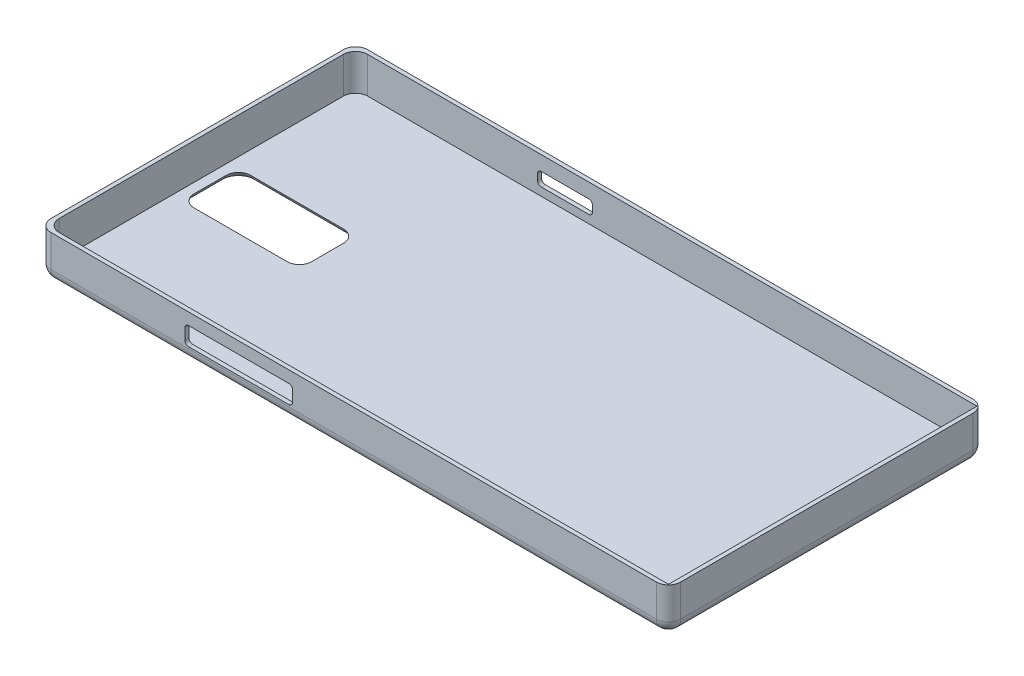
from build123d import *

# Parameters (mm, degrees)
SKETCH1_W           = 154.9
SKETCH1_H           = 77.9
BOSS_EXTRUDE1_DEPTH = 10.9
SKETCH8_W           = 152.9
SKETCH8_H           = 75.9
CUT_EXTRUDE3_DEPTH  = 8.9
FILLET6_R           = 2.99
FILLET7_R           = 2.99
FILLET8_R           = 2.99
FILLET9_R           = 2.99
FILLET10_R          = 2.99
FILLET11_R          = 2.99
FILLET12_R          = 2.99
FILLET13_R          = 2.99
SKETCH12_W          = 28.9
SKETCH12_H          = 13.9
CUT_EXTRUDE4_DEPTH  = 88.148235782
FILLET15_R          = 2.99
FILLET16_R          = 2.99
FILLET17_R          = 2.99
FILLET18_R          = 2.99
CUT_EXTRUDE8_REACH  = 112.389
SKETCH15_W          = 26.5
SKETCH15_H          = 4.5
CUT_EXTRUDE9_REACH  = 112.389
SKETCH16_W          = 13.5
SKETCH16_H          = 3.3
FILLET19_R          = 2.99
FILLET22_R          = 0.9
FILLET23_R          = 0.9
FILLET24_R          = 0.9
FILLET25_R          = 0.9
FILLET29_R          = 0.9
FILLET39_R          = 2.99
SKETCH6_W           = 152.9
SKETCH6_H           = 75.9
CUT_EXTRUDE2_DEPTH  = 8.9
FILLET4_R           = 2.99
FILLET5_R           = 2.99


with BuildPart() as part:
    # Sketch1 → Boss-Extrude1 (new body)
    with BuildSketch(Plane(origin=(0, 0, 0), x_dir=(1, 0, 0), z_dir=(0, 1, 0))):
        Rectangle(SKETCH1_W, SKETCH1_H)
    extrude(amount=BOSS_EXTRUDE1_DEPTH)

    # Sketch8 → Cut-Extrude3 (cut)
    with BuildSketch(Plane(origin=(0, 10.9, 0), x_dir=(1, 0, 0), z_dir=(0, 1, 0))):
        Rectangle(SKETCH8_W, SKETCH8_H)
    extrude(amount=-CUT_EXTRUDE3_DEPTH, mode=Mode.SUBTRACT)

    # Fillet6
    fillet6_edges = [part.edges().sort_by_distance(p)[0] for p in [
        (-76.45, 6.45, -37.95),
    ]]
    fillet(fillet6_edges, radius=FILLET6_R)

    # Fillet7
    fillet7_edges = [part.edges().sort_by_distance(p)[0] for p in [
        (-76.45, 6.45, 37.95),
    ]]
    fillet(fillet7_edges, radius=FILLET7_R)

    # Fillet8
    fillet8_edges = [part.edges().sort_by_distance(p)[0] for p in [
        (76.45, 6.45, -37.95),
    ]]
    fillet(fillet8_edges, radius=FILLET8_R)

    # Fillet9
    fillet9_edges = [part.edges().sort_by_distance(p)[0] for p in [
        (76.45, 6.45, 37.95),
    ]]
    fillet(fillet9_edges, radius=FILLET9_R)

    # Fillet10
    fillet10_edges = [part.edges().sort_by_distance(p)[0] for p in [
        (77.45, 5.45, 38.95),
    ]]
    fillet(fillet10_edges, radius=FILLET10_R)

    # Fillet11
    fillet11_edges = [part.edges().sort_by_distance(p)[0] for p in [
        (-77.45, 5.45, 38.95),
    ]]
    fillet(fillet11_edges, radius=FILLET11_R)

    # Fillet12
    fillet12_edges = [part.edges().sort_by_distance(p)[0] for p in [
        (-77.45, 5.45, -38.95),
    ]]
    fillet(fillet12_edges, radius=FILLET12_R)

    # Fillet13
    fillet13_edges = [part.edges().sort_by_distance(p)[0] for p in [
        (1.495, 0, -38.95),
        (77.45, 0, -1.495),
        (76.574249276, 0, 38.074249276),
        (0, 0, 38.95),
        (-76.574249276, 0, 38.074249276),
        (-77.45, 0, 0),
        (-76.574249276, 0, -38.074249276),
    ]]
    fillet(fillet13_edges, radius=FILLET13_R)

    # Sketch12 → Cut-Extrude4 (cut, through all)
    with BuildSketch(Plane(origin=(0, 2, 0), x_dir=(1, 0, 0), z_dir=(0, 1, 0))):
        with Locations((-59.543133303, -0.270064355)):
            Rectangle(SKETCH12_W, SKETCH12_H)
    extrude(amount=-CUT_EXTRUDE4_DEPTH, mode=Mode.SUBTRACT)

    # Fillet15
    fillet15_edges = [part.edges().sort_by_distance(p)[0] for p in [
        (-73.993133303, 1, -6.679935645),
    ]]
    fillet(fillet15_edges, radius=FILLET15_R)

    # Fillet16
    fillet16_edges = [part.edges().sort_by_distance(p)[0] for p in [
        (-73.993133303, 1, 7.220064355),
    ]]
    fillet(fillet16_edges, radius=FILLET16_R)

    # Fillet17
    fillet17_edges = [part.edges().sort_by_distance(p)[0] for p in [
        (-45.093133303, 1, 7.220064355),
    ]]
    fillet(fillet17_edges, radius=FILLET17_R)

    # Fillet18
    fillet18_edges = [part.edges().sort_by_distance(p)[0] for p in [
        (-45.093133303, 1, -6.679935645),
    ]]
    fillet(fillet18_edges, radius=FILLET18_R)

    # Sketch15 → Cut-Extrude8 (cut, up to next)
    with BuildSketch(Plane.XY.offset(38.95), mode=Mode.PRIVATE) as cut_extrude8_sk1:
        with Locations((-28.269520984, 5.746289853)):
            Rectangle(SKETCH15_W, SKETCH15_H)
    cut_extrude8_tool1 = extrude(cut_extrude8_sk1.sketch, amount=-CUT_EXTRUDE8_REACH, mode=Mode.PRIVATE) & part.part
    add(cut_extrude8_tool1.solids().sort_by_distance((-28.269521, 5.74629, 38.95))[0], mode=Mode.SUBTRACT)

    # Sketch16 → Cut-Extrude9 (cut, up to next)
    with BuildSketch(Plane(origin=(0, 0, -38.95), x_dir=(-1, 0, 0), z_dir=(0, 0, -1)), mode=Mode.PRIVATE) as cut_extrude9_sk1:
        with Locations((24.905722524, 5.653111576)):
            Rectangle(SKETCH16_W, SKETCH16_H)
    cut_extrude9_tool1 = extrude(cut_extrude9_sk1.sketch, amount=-CUT_EXTRUDE9_REACH, mode=Mode.PRIVATE) & part.part
    add(cut_extrude9_tool1.solids().sort_by_distance((-24.905723, 5.653112, -38.95))[0], mode=Mode.SUBTRACT)

    # Fillet19
    # the kernel refuses this fillet: 2.99 mm, written as the material it takes off along each edge
    with BuildSketch(Plane(origin=(-71.003133303, 0, 4.230064355), x_dir=(-1, 0, 0), z_dir=(0, 0, -1))) as fillet19_piece_1:
        with BuildLine():
            CenterArc((5.811347196, 2.99), FILLET19_R, 199.335777997, 70.664222003)
            Line((2.99, 2), (2.933573056, 1.9802))
            ThreePointArc((2.933573056, 1.9802), (2.9302, 1), (2.9302, 0))
            Line((2.9302, 0), (2.99, -0.0598))
            Line((2.99, -0.0598), (5.811347196, -0.0598))
            Line((5.811347196, -0.0598), (5.811347196, 0))
        make_face()
    revolve(axis=Axis((-71.003133303, 0, 4.230064355), (0, 1, 0)), revolution_arc=90, mode=Mode.SUBTRACT)
    with BuildSketch(Plane(origin=(-73.993133303, 0, -3.689935645), x_dir=(-1, 0, 0), z_dir=(0, 0, 1)), Plane(origin=(-45.093133303, 0, 4.230064355), x_dir=(1, 0, 0), z_dir=(0, 0, -1))) as fillet19_piece_2:
        with BuildLine():
            CenterArc((2.821347196, -2.99), FILLET19_R, 90, 70.664222003)
            Line((0, -2), (-0.056426944, -1.9802))
            ThreePointArc((-0.056426944, -1.9802), (-0.0598, -1), (-0.0598, 0))
            Line((-0.0598, 0), (0, 0.0598))
            Line((0, 0.0598), (2.821347196, 0.0598))
            Line((2.821347196, 0.0598), (2.821347196, 0))
        make_face()
    extrude(amount=7.92, mode=Mode.SUBTRACT)
    with BuildSketch(Plane(origin=(-71.003133303, 0, -3.689935645), x_dir=(0, 0, -1), z_dir=(1, 0, 0))) as fillet19_piece_3:
        with BuildLine():
            CenterArc((5.811347196, 2.99), FILLET19_R, 199.335777997, 70.664222003)
            Line((2.99, 2), (2.933573056, 1.9802))
            ThreePointArc((2.933573056, 1.9802), (2.9302, 1), (2.9302, 0))
            Line((2.9302, 0), (2.99, -0.0598))
            Line((2.99, -0.0598), (5.811347196, -0.0598))
            Line((5.811347196, -0.0598), (5.811347196, 0))
        make_face()
    revolve(axis=Axis((-71.003133303, 0, -3.689935645), (0, 1, 0)), revolution_arc=90, mode=Mode.SUBTRACT)
    with BuildSketch(Plane(origin=(-48.083133303, 0, -6.679935645), x_dir=(0, 0, -1), z_dir=(-1, 0, 0)), Plane(origin=(-71.003133303, 0, 7.220064355), x_dir=(0, 0, 1), z_dir=(1, 0, 0))) as fillet19_piece_4:
        with BuildLine():
            CenterArc((2.821347196, -2.99), FILLET19_R, 90, 70.664222003)
            Line((0, -2), (-0.056426944, -1.9802))
            ThreePointArc((-0.056426944, -1.9802), (-0.0598, -1), (-0.0598, 0))
            Line((-0.0598, 0), (0, 0.0598))
            Line((0, 0.0598), (2.821347196, 0.0598))
            Line((2.821347196, 0.0598), (2.821347196, 0))
        make_face()
    extrude(amount=22.92, mode=Mode.SUBTRACT)
    with BuildSketch(Plane(origin=(-48.083133303, 0, -3.689935645), x_dir=(1, 0, 0), z_dir=(0, 0, 1))) as fillet19_piece_5:
        with BuildLine():
            CenterArc((5.811347196, 2.99), FILLET19_R, 199.335777997, 70.664222003)
            Line((2.99, 2), (2.933573056, 1.9802))
            ThreePointArc((2.933573056, 1.9802), (2.9302, 1), (2.9302, 0))
            Line((2.9302, 0), (2.99, -0.0598))
            Line((2.99, -0.0598), (5.811347196, -0.0598))
            Line((5.811347196, -0.0598), (5.811347196, 0))
        make_face()
    revolve(axis=Axis((-48.083133303, 0, -3.689935645), (0, 1, 0)), revolution_arc=90, mode=Mode.SUBTRACT)
    with BuildSketch(Plane(origin=(-48.083133303, 0, 4.230064355), x_dir=(0, 0, 1), z_dir=(-1, 0, 0))) as fillet19_piece_6:
        with BuildLine():
            CenterArc((5.811347196, 2.99), FILLET19_R, 199.335777997, 70.664222003)
            Line((2.99, 2), (2.933573056, 1.9802))
            ThreePointArc((2.933573056, 1.9802), (2.9302, 1), (2.9302, 0))
            Line((2.9302, 0), (2.99, -0.0598))
            Line((2.99, -0.0598), (5.811347196, -0.0598))
            Line((5.811347196, -0.0598), (5.811347196, 0))
        make_face()
    revolve(axis=Axis((-48.083133303, 0, 4.230064355), (0, 1, 0)), revolution_arc=90, mode=Mode.SUBTRACT)

    # Fillet22
    fillet22_edges = [part.edges().sort_by_distance(p)[0] for p in [
        (-15.019520984, 7.996289853, 38.45),
    ]]
    fillet(fillet22_edges, radius=FILLET22_R)

    # Fillet23
    fillet23_edges = [part.edges().sort_by_distance(p)[0] for p in [
        (-41.519520984, 7.996289853, 38.45),
    ]]
    fillet(fillet23_edges, radius=FILLET23_R)

    # Fillet24
    fillet24_edges = [part.edges().sort_by_distance(p)[0] for p in [
        (-15.019520984, 3.496289853, 38.45),
    ]]
    fillet(fillet24_edges, radius=FILLET24_R)

    # Fillet25
    fillet25_edges = [part.edges().sort_by_distance(p)[0] for p in [
        (-41.519520984, 3.496289853, 38.45),
    ]]
    fillet(fillet25_edges, radius=FILLET25_R)

    # Fillet29
    fillet29_edges = [part.edges().sort_by_distance(p)[0] for p in [
        (-31.655722524, 7.303111576, -38.45),
        (-31.655722524, 4.003111576, -38.45),
        (-18.155722524, 4.003111576, -38.45),
        (-18.155722524, 7.303111576, -38.45),
    ]]
    fillet(fillet29_edges, radius=FILLET29_R)

    # Fillet39
    # the kernel refuses this fillet: 2.99 mm, written as the material it takes off along each edge
    with BuildSketch(Plane(origin=(74.46, 2.99, -35.96), x_dir=(1, 0, 0), z_dir=(0, 0, -1))) as fillet39_piece_1_section:
        Polygon((0, 0), (FILLET39_R, 0), (FILLET39_R, FILLET39_R), (0, FILLET39_R), align=None)
    fillet39_piece_1 = extrude(amount=FILLET39_R, mode=Mode.PRIVATE)
    fillet39_piece_1 = fillet39_piece_1 - Plane(origin=(74.46, 2.99, -35.96), x_dir=(-0.7071067811865475, 0.7071067811865475, 0), z_dir=(0, 0, -1)) * Sphere(FILLET39_R, mode=Mode.PRIVATE)
    add(fillet39_piece_1, mode=Mode.SUBTRACT)
    with BuildSketch(Plane(origin=(77.45, 2.99, -38.95), x_dir=(-1, 0, 0), z_dir=(0, 1, 0))) as fillet39_piece_2:
        with BuildLine():
            CenterArc((FILLET39_R, FILLET39_R), FILLET39_R, 180, 90)
            Line((0, FILLET39_R), (0, 0))
            Line((0, 0), (FILLET39_R, 0))
        make_face()
    extrude(amount=15.385, mode=Mode.SUBTRACT)

    # Sketch6 → Cut-Extrude2 (cut)
    with BuildSketch(Plane(origin=(0, 10.9, 0), x_dir=(1, 0, 0), z_dir=(0, 1, 0))):
        Rectangle(SKETCH6_W, SKETCH6_H)
    extrude(amount=-CUT_EXTRUDE2_DEPTH, mode=Mode.SUBTRACT)

    # Fillet4
    fillet4_edges = [part.edges().sort_by_distance(p)[0] for p in [
        (-76.45, 6.45, -37.95),
    ]]
    fillet(fillet4_edges, radius=FILLET4_R)

    # Fillet5
    fillet5_edges = [part.edges().sort_by_distance(p)[0] for p in [
        (-76.45, 6.45, 37.95),
    ]]
    fillet(fillet5_edges, radius=FILLET5_R)


solid = part.part
